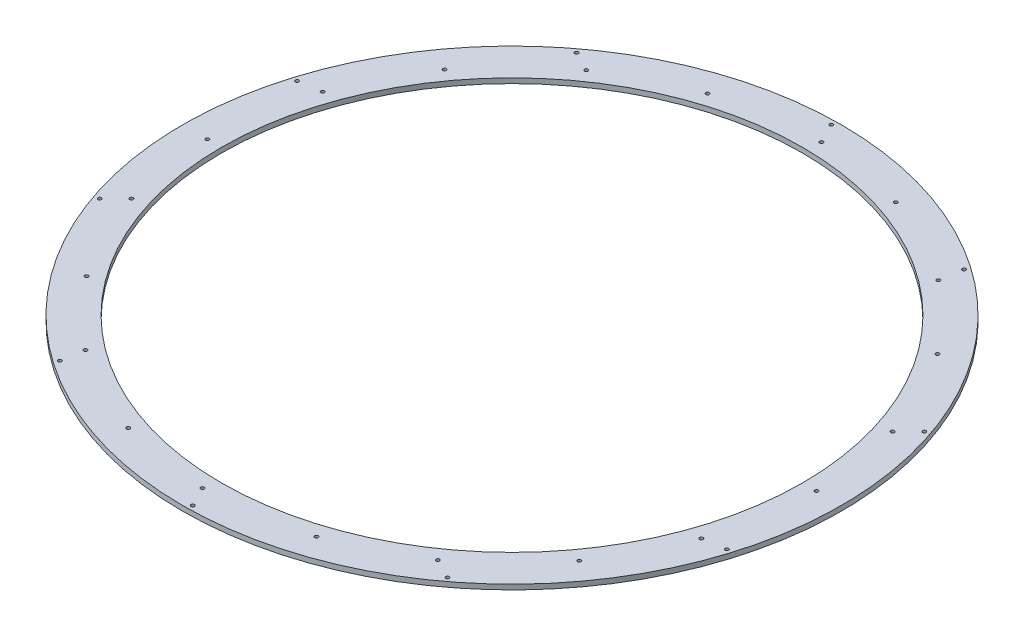
from build123d import *

# Parameters (mm, degrees)
SKETCH1_R           = 330
SKETCH1_R_2         = 291
BOSS_EXTRUDE1_DEPTH = 5
SKETCH2_R           = 1.75
CUT_EXTRUDE1_DEPTH  = 467.717259162
CIRPATTERN1_COUNT   = 10


with BuildPart() as part:
    # Sketch1 → Boss-Extrude1 (new body)
    with BuildSketch(Plane(origin=(0, 0, 0), x_dir=(1, 0, 0), z_dir=(0, 1, 0))):
        Circle(SKETCH1_R)
        Circle(SKETCH1_R_2, mode=Mode.SUBTRACT)
    extrude(amount=-BOSS_EXTRUDE1_DEPTH)

    # Sketch2 → Cut-Extrude1 (cut, through all)
    with BuildSketch(Plane(origin=(0, 0, 0), x_dir=(1, 0, 0), z_dir=(0, 1, 0))):
        with Locations((5.238528177, -324.957778523)):
            Circle(SKETCH2_R)
        with Locations((94.250183284, -290.07223747)):
            Circle(SKETCH2_R)
        with Locations((175.273957266, -249.607772124)):
            Circle(SKETCH2_R)
    cut_extrude1 = extrude(amount=-CUT_EXTRUDE1_DEPTH, mode=Mode.SUBTRACT)

    # CirPattern1: Cut-Extrude1 ×10 about axis
    cirpattern1_axis = Axis((0, -5, 0), (0, 1, 0))
    for i in range(1, CIRPATTERN1_COUNT):
        add(cut_extrude1.rotate(cirpattern1_axis, i * 360 / CIRPATTERN1_COUNT), mode=Mode.SUBTRACT)


solid = part.part
